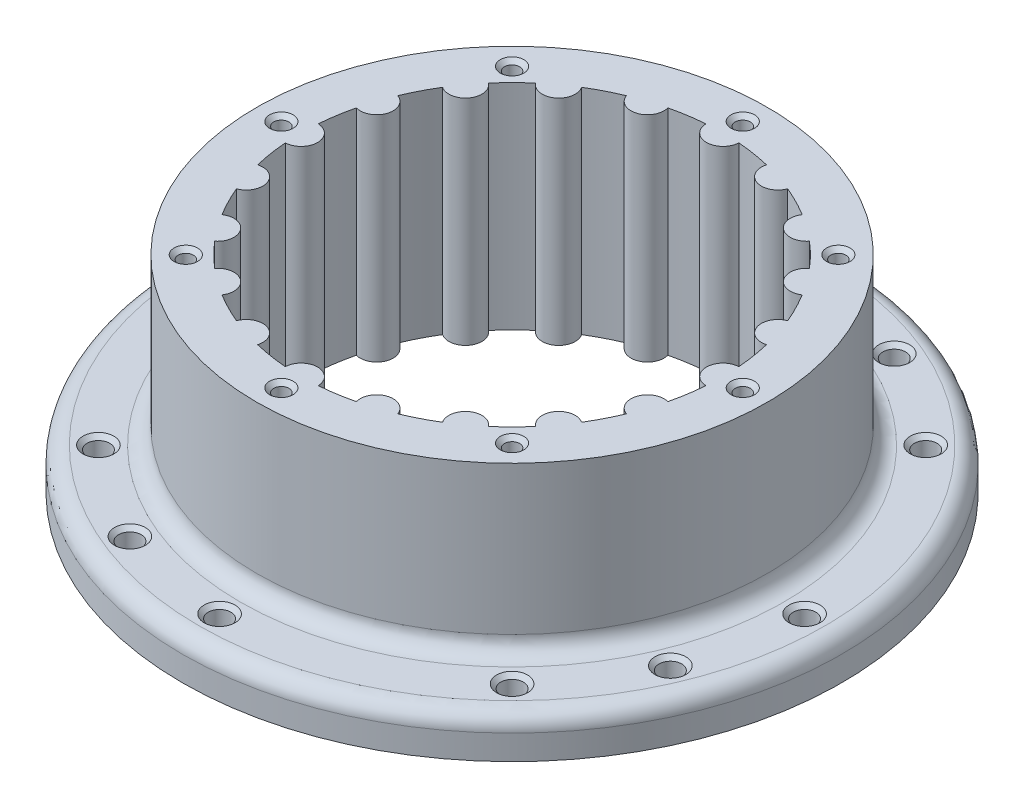
from build123d import *

# Parameters (mm, degrees)
SKETCH1_R                       = 80
SKETCH1_R_2                     = 62
BOSS_EXTRUDE1_DEPTH             = 10
BOSS_EXTRUDE2_DEPTH             = 40
BOSS_EXTRUDE2_DEPTH_BACK        = 12
SKETCH4_R                       = 62
SKETCH4_R_2                     = 51.2
BOSS_EXTRUDE3_REACH             = 122
BOSS_EXTRUDE3_DIRECTION_2_REACH = 122
CIRPATTERN1_COUNT               = 20
SKETCH8_R                       = 2.75
CUT_EXTRUDE4_DEPTH              = 121
CHAMFER1_SIZE                   = 1
CIRPATTERN2_COUNT               = 8
CHAMFER1_OF_CIRPATTERN2_SIZE    = 1
CHAMFER2_SIZE                   = 0.5
SKETCH9_R                       = 1.85
CUT_EXTRUDE5_DEPTH              = 15
CHAMFER3_SIZE                   = 1
SKETCH10_R                      = 2.75
CUT_EXTRUDE6_DEPTH              = 121
CHAMFER4_SIZE                   = 1
CIRPATTERN4_COUNT               = 4
CHAMFER4_OF_CIRPATTERN4_SIZE    = 1
CIRPATTERN3_COUNT               = 8
CHAMFER3_OF_CIRPATTERN3_SIZE    = 1
FILLET1_R                       = 4
FILLET2_R                       = 4


with BuildPart() as part:
    # Sketch1 → Boss-Extrude1 (new body)
    with BuildSketch(Plane(origin=(0, 0, 0), x_dir=(1, 0, 0), z_dir=(0, 1, 0))):
        Circle(SKETCH1_R)
        Circle(SKETCH1_R_2, mode=Mode.SUBTRACT)
    extrude(amount=BOSS_EXTRUDE1_DEPTH)

    # Sketch4 → Boss-Extrude2 (add, two sides: drawn at the far end of the back side and taken through both)
    with BuildSketch(Plane(origin=(0, 10, 0), x_dir=(1, 0, 0), z_dir=(0, 1, 0)).offset(-BOSS_EXTRUDE2_DEPTH_BACK)):
        Circle(SKETCH4_R)
        Circle(SKETCH4_R_2, mode=Mode.SUBTRACT)
    extrude(amount=BOSS_EXTRUDE2_DEPTH + BOSS_EXTRUDE2_DEPTH_BACK)

    # Boss-Extrude3: up to this face of the body (flat: up to its plane)
    boss_extrude3_end = Plane(part.part.faces().sort_by_distance((-60.246375183, 50, 0))[0])
    # Sketch5 → Boss-Extrude3 (add, up to the picked face)
    with BuildSketch(Plane(origin=(0, 10, 0), x_dir=(1, 0, 0), z_dir=(0, 1, 0)), mode=Mode.PRIVATE) as boss_extrude3_sk1:
        with BuildLine():
            ThreePointArc((-51.04375, -3.996947077), (-47.2, 0), (-51.04375, 3.996947077))
            ThreePointArc((-51.04375, 3.996947077), (-51.2, 0), (-51.04375, -3.996947077))
        make_face()
    boss_extrude3_tool1 = split(extrude(boss_extrude3_sk1.sketch, amount=BOSS_EXTRUDE3_REACH, mode=Mode.PRIVATE), bisect_by=boss_extrude3_end, keep=Keep.BOTH, mode=Mode.PRIVATE)
    boss_extrude3 = boss_extrude3_tool1.solids().sort_by(Axis((-49.474514, 10, 0), (0, 1, 0)))[0]
    add(boss_extrude3)

    # Boss-Extrude3 direction 2: up to this face of the body (flat: up to its plane)
    boss_extrude3_direction_2_end = Plane(part.part.faces().sort_by_distance((-60.246375183, -2, 0))[0])
    # Sketch5 → Boss-Extrude3 direction 2 (add, up to the picked face)
    with BuildSketch(Plane(origin=(0, 10, 0), x_dir=(1, 0, 0), z_dir=(0, 1, 0)), mode=Mode.PRIVATE) as boss_extrude3_direction_2_sk1:
        with BuildLine():
            ThreePointArc((-51.04375, -3.996947077), (-47.2, 0), (-51.04375, 3.996947077))
            ThreePointArc((-51.04375, 3.996947077), (-51.2, 0), (-51.04375, -3.996947077))
        make_face()
    boss_extrude3_direction_2_tool1 = split(extrude(boss_extrude3_direction_2_sk1.sketch, amount=-BOSS_EXTRUDE3_DIRECTION_2_REACH, mode=Mode.PRIVATE), bisect_by=boss_extrude3_direction_2_end, keep=Keep.BOTH, mode=Mode.PRIVATE)
    boss_extrude3_direction_2 = boss_extrude3_direction_2_tool1.solids().sort_by(Axis((-49.474514, 10, 0), (0, -1, 0)))[0]
    add(boss_extrude3_direction_2)

    # CirPattern1: Boss-Extrude3, Boss-Extrude3 direction 2 ×20 about axis
    cirpattern1_axis = Axis((0, 50, 0), (0, 1, 0))
    add([boss_extrude3.rotate(cirpattern1_axis, i * 360 / CIRPATTERN1_COUNT) for i in range(1, CIRPATTERN1_COUNT)])
    add([boss_extrude3_direction_2.rotate(cirpattern1_axis, i * 360 / CIRPATTERN1_COUNT) for i in range(1, CIRPATTERN1_COUNT)])

    # Sketch8 → Cut-Extrude4 (cut, through all)
    with BuildSketch(Plane(origin=(0, 10, 0), x_dir=(1, 0, 0), z_dir=(0, 1, 0))):
        with Locations((0, 71)):
            Circle(SKETCH8_R)
    cut_extrude4 = extrude(amount=-CUT_EXTRUDE4_DEPTH, mode=Mode.SUBTRACT)

    # Chamfer1
    chamfer1_edges = [part.edges().sort_by_distance(p)[0] for p in [
        (-2.75, 10, -71),
    ]]
    chamfer(chamfer1_edges, length=CHAMFER1_SIZE)

    # CirPattern2: Cut-Extrude4 ×8 about axis
    cirpattern2_axis = Axis((0, 10, 0), (0, 1, 0))
    for i in range(1, CIRPATTERN2_COUNT):
        add(cut_extrude4.rotate(cirpattern2_axis, i * 360 / CIRPATTERN2_COUNT), mode=Mode.SUBTRACT)

    # Chamfer1 of CirPattern2
    chamfer1_of_cirpattern2_edges = [part.edges().sort_by_distance(p)[0] for p in [
        (-52.149125113, 10, -48.260037816),
        (-71, 10, 2.75),
        (-48.260037816, 10, 52.149125113),
        (2.75, 10, 71),
        (52.149125113, 10, 48.260037816),
        (71, 10, -2.75),
        (48.260037816, 10, -52.149125113),
    ]]
    chamfer(chamfer1_of_cirpattern2_edges, length=CHAMFER1_OF_CIRPATTERN2_SIZE)

    # Chamfer2
    chamfer2_edges = [part.edges().sort_by_distance(p)[0] for p in [
        (-62, -2, 0),
    ]]
    chamfer(chamfer2_edges, length=CHAMFER2_SIZE)

    # Sketch9 → Cut-Extrude5 (cut)
    with BuildSketch(Plane(origin=(0, 50, 0), x_dir=(1, 0, 0), z_dir=(0, 1, 0))):
        with Locations((0, 56)):
            Circle(SKETCH9_R)
    cut_extrude5 = extrude(amount=-CUT_EXTRUDE5_DEPTH, mode=Mode.SUBTRACT)

    # Chamfer3
    chamfer3_edges = [part.edges().sort_by_distance(p)[0] for p in [
        (-1.85, 50, -56),
    ]]
    chamfer(chamfer3_edges, length=CHAMFER3_SIZE)

    # Sketch10 → Cut-Extrude6 (cut, through all)
    with BuildSketch(Plane(origin=(0, 10, 0), x_dir=(1, 0, 0), z_dir=(0, 1, 0))):
        with Locations((27.170523698, 65.595446808)):
            Circle(SKETCH10_R)
    cut_extrude6 = extrude(amount=-CUT_EXTRUDE6_DEPTH, mode=Mode.SUBTRACT)

    # Chamfer4
    chamfer4_edges = [part.edges().sort_by_distance(p)[0] for p in [
        (24.420523698, 10, -65.595446808),
    ]]
    chamfer(chamfer4_edges, length=CHAMFER4_SIZE)

    # CirPattern4: Cut-Extrude6 ×4 about axis
    cirpattern4_axis = Axis((0, 10, 0), (0, 1, 0))
    for i in range(1, CIRPATTERN4_COUNT):
        add(cut_extrude6.rotate(cirpattern4_axis, i * 360 / CIRPATTERN4_COUNT), mode=Mode.SUBTRACT)

    # Chamfer4 of CirPattern4
    chamfer4_of_cirpattern4_edges = [part.edges().sort_by_distance(p)[0] for p in [
        (-65.595446808, 10, -24.420523698),
        (-24.420523698, 10, 65.595446808),
        (65.595446808, 10, 24.420523698),
    ]]
    chamfer(chamfer4_of_cirpattern4_edges, length=CHAMFER4_OF_CIRPATTERN4_SIZE)

    # CirPattern3: Cut-Extrude5 ×8 about axis
    cirpattern3_axis = Axis((0, 50, 0), (0, 1, 0))
    for i in range(1, CIRPATTERN3_COUNT):
        add(cut_extrude5.rotate(cirpattern3_axis, i * 360 / CIRPATTERN3_COUNT), mode=Mode.SUBTRACT)

    # Chamfer3 of CirPattern3
    chamfer3_of_cirpattern3_edges = [part.edges().sort_by_distance(p)[0] for p in [
        (-40.906127292, 50, -38.289832201),
        (-56, 50, 1.85),
        (-38.289832201, 50, 40.906127292),
        (1.85, 50, 56),
        (40.906127292, 50, 38.289832201),
        (56, 50, -1.85),
        (38.289832201, 50, -40.906127292),
    ]]
    chamfer(chamfer3_of_cirpattern3_edges, length=CHAMFER3_OF_CIRPATTERN3_SIZE)

    # Fillet1
    fillet1_edges = [part.edges().sort_by_distance(p)[0] for p in [
        (-62, 10, 0),
    ]]
    fillet(fillet1_edges, radius=FILLET1_R)

    # Fillet2
    fillet2_edges = [part.edges().sort_by_distance(p)[0] for p in [
        (-80, 10, 0),
    ]]
    fillet(fillet2_edges, radius=FILLET2_R)


solid = part.part
